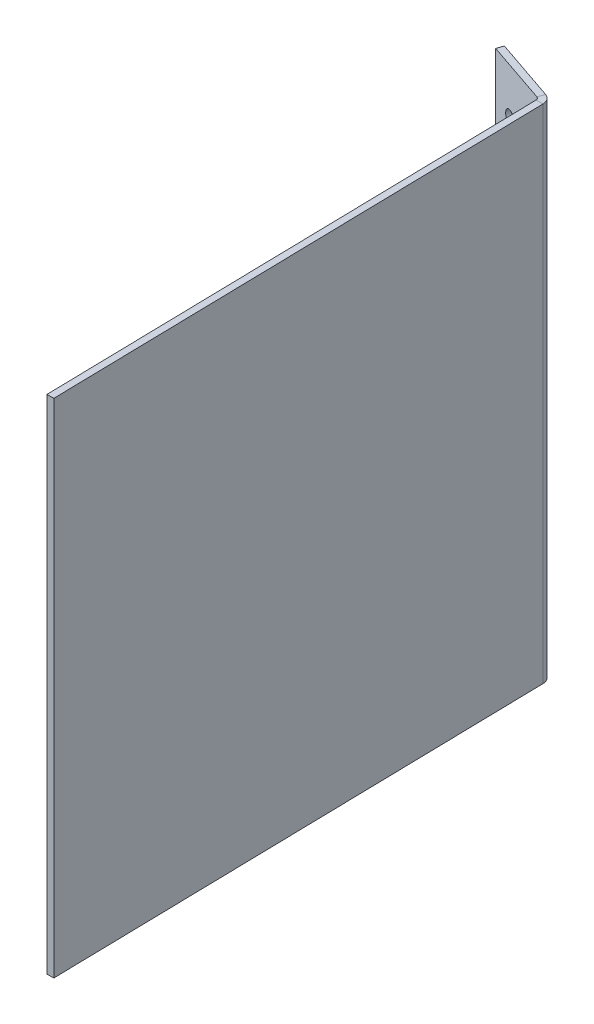
from build123d import *

# Parameters (mm, degrees)
BASE_FLANGE1_DEPTH          = 110
F_3_0MM_PRESS_DOWEL_HOLE1_D = 3


# Sheet-metal steps are written as plain solids
with BuildPart() as part:
    # Sketch1 → Base-Flange1 (new body)
    with BuildSketch(Plane(origin=(0, 0, 0), x_dir=(1, 0, 0), z_dir=(0, 1, 0))):
        with BuildLine():
            Line((0, 0), (-2.270295707, 109.460685851))
            ThreePointArc((-2.270295707, 109.460685851), (-2.412240672, 109.880329075), (-2.769212645, 110.142664393))
            Line((-2.769212645, 110.142664393), (-16.479732829, 114.813260902))
            Line((-16.479732829, 114.813260902), (-15.996041521, 116.233135093))
            Line((-15.996041521, 116.233135093), (-2.285521337, 111.562538584))
            ThreePointArc((-2.285521337, 111.562538584), (-1.201617569, 110.765987985), (-0.770618236, 109.491790273))
            Line((-0.770618236, 109.491790273), (1.49967747, 0.031104422))
            Line((1.49967747, 0.031104422), (0, 0))
        make_face()
    extrude(amount=BASE_FLANGE1_DEPTH)

    # Ø3.0mm Press Dowel Hole1 (through all)
    with Locations(Plane(origin=(33.81524251, 0, -99.264529514), x_dir=(-0.9465827940969574, 0, -0.32246087192029516), z_dir=(0.32246087192029516, 0, -0.9465827940969574))):
        with Locations((47.622215766, 10), (47.622215766, 100)):
            Hole(F_3_0MM_PRESS_DOWEL_HOLE1_D / 2)


solid = part.part
